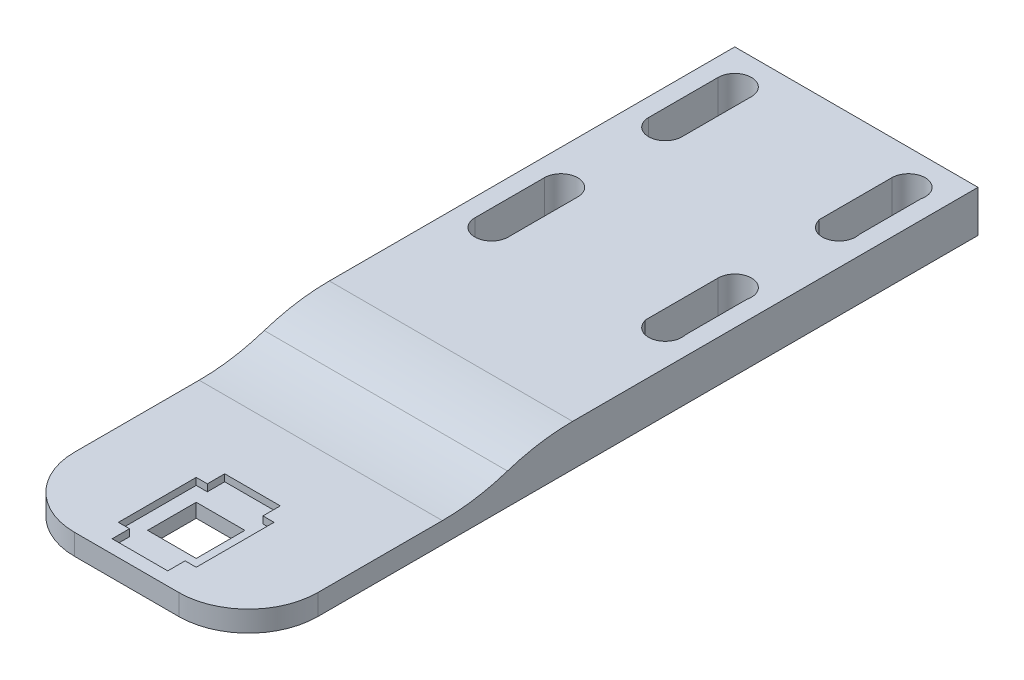
from build123d import *

# Parameters (mm, degrees)
SKETCH1_W            = 35
SKETCH1_H            = 105
BOSS_EXTRUDE1_DEPTH  = 6
M4_CLEARANCE_HOLE1_D = 4.8
LPATTERN2_COUNT      = 2
LPATTERN2_PITCH      = 10
SKETCH5_W            = 4.8
SKETCH5_H            = 10
SKETCH5_W_2          = 4.730666207
SKETCH5_H_2          = 10.572708501
CUT_EXTRUDE1_DEPTH   = 88.085432636
SKETCH6_W            = 11.2
SKETCH6_H            = 11.2
CUT_EXTRUDE2_DEPTH   = 4
SKETCH7_W            = 7
SKETCH7_H            = 7
CUT_EXTRUDE3_DEPTH   = 87.970527062
SKETCH8_W            = 8
SKETCH8_H            = 16.2
CUT_EXTRUDE4_DEPTH   = 4
FILLET1_R            = 10
CUT_EXTRUDE5_START   = -6
SKETCH9_W            = 37.049954943
SKETCH9_H            = 41
CUT_EXTRUDE5_DEPTH   = 3
FILLET2_R            = 30
FILLET3_R            = 30


with BuildPart() as part:
    # Sketch1 → Boss-Extrude1 (new body)
    with BuildSketch(Plane(origin=(0, 0, 0), x_dir=(1, 0, 0), z_dir=(0, 1, 0))):
        with Locations((0.111940299, -32.574626866)):
            Rectangle(SKETCH1_W, SKETCH1_H)
    extrude(amount=BOSS_EXTRUDE1_DEPTH)

    # M4 Clearance Hole1 (through all)
    with Locations(Plane(origin=(0, 6, 0), x_dir=(1, 0, 0), z_dir=(0, 1, 0))):
        with Locations((-12.388059701, 14.925373134), (12.611940299, 14.925373134), (12.611940299, -10.074626866), (-12.388059701, -10.074626866)):
            m4_clearance_hole1 = Hole(M4_CLEARANCE_HOLE1_D / 2)

    # LPattern2: M4 Clearance Hole1 ×2
    with Locations(*[(0, 0, i * LPATTERN2_PITCH) for i in range(1, LPATTERN2_COUNT)]):
        add(m4_clearance_hole1, mode=Mode.SUBTRACT)

    # Sketch5 → Cut-Extrude1 (cut, through all)
    with BuildSketch(Plane(origin=(0, 6, 0), x_dir=(1, 0, 0), z_dir=(0, 1, 0))):
        with Locations((-12.388059701, 9.925373134)):
            Rectangle(SKETCH5_W, SKETCH5_H)
        with Locations((-12.388059701, -15.074626866)):
            Rectangle(SKETCH5_W, SKETCH5_H)
        with Locations((12.577273403, 9.639018884)):
            Rectangle(SKETCH5_W_2, SKETCH5_H_2)
        with Locations((12.577273403, -15.360981116)):
            Rectangle(SKETCH5_W_2, SKETCH5_H_2)
    extrude(amount=-CUT_EXTRUDE1_DEPTH, mode=Mode.SUBTRACT)

    # Sketch6 → Cut-Extrude2 (cut)
    with BuildSketch(Plane(origin=(0, 6, 0), x_dir=(1, 0, 0), z_dir=(0, 1, 0))):
        with Locations((0.111940299, -75.074626866)):
            Rectangle(SKETCH6_W, SKETCH6_H)
    extrude(amount=-CUT_EXTRUDE2_DEPTH, mode=Mode.SUBTRACT)

    # Sketch7 → Cut-Extrude3 (cut, through all)
    with BuildSketch(Plane(origin=(0, 2, 0), x_dir=(1, 0, 0), z_dir=(0, 1, 0))):
        with Locations((0.111940299, -75.074626866)):
            Rectangle(SKETCH7_W, SKETCH7_H)
    extrude(amount=-CUT_EXTRUDE3_DEPTH, mode=Mode.SUBTRACT)

    # Sketch8 → Cut-Extrude4 (cut)
    with BuildSketch(Plane(origin=(0, 6, 0), x_dir=(1, 0, 0), z_dir=(0, 1, 0))):
        with Locations((0.111940299, -75.074626866)):
            Rectangle(SKETCH8_W, SKETCH8_H)
    extrude(amount=-CUT_EXTRUDE4_DEPTH, mode=Mode.SUBTRACT)

    # Fillet1
    fillet1_edges = [part.edges().sort_by_distance(p)[0] for p in [
        (17.611940299, 3, 85.074626866),
        (-17.388059701, 3, 85.074626866),
    ]]
    fillet(fillet1_edges, radius=FILLET1_R)

    # Sketch9 → Cut-Extrude5 (cut)
    with BuildSketch(Plane.XZ.offset(CUT_EXTRUDE5_START)):
        with Locations((1.136917771, 64.574626866)):
            Rectangle(SKETCH9_W, SKETCH9_H)
    extrude(amount=CUT_EXTRUDE5_DEPTH, mode=Mode.SUBTRACT)

    # Fillet2
    # the kernel refuses this fillet: 30 mm, written as the material it adds along each edge
    with BuildSketch(Plane(origin=(-17.388059701, 3, 44.074626866), x_dir=(0, 1, 0), z_dir=(1, 0, 0))) as fillet2_piece_1:
        with BuildLine():
            CenterArc((30, 13.076696831), FILLET2_R, 180, 25.841932763)
            Line((0, 13.076696831), (-0.6, 13.076696831))
            Line((-0.6, 13.076696831), (-0.6, 0))
            Line((-0.6, 0), (0, -0.6))
            ThreePointArc((0, -0.6), (1.5, -0.6), (2.46, -0.261533937))
            Line((2.46, -0.261533937), (3, 0))
        make_face()
    extrude(amount=35)

    # Fillet3
    fillet3_edges = [part.edges().sort_by_distance(p)[0] for p in [
        (0.111940299, 6, 44.074626866),
    ]]
    fillet(fillet3_edges, radius=FILLET3_R)


solid = part.part
